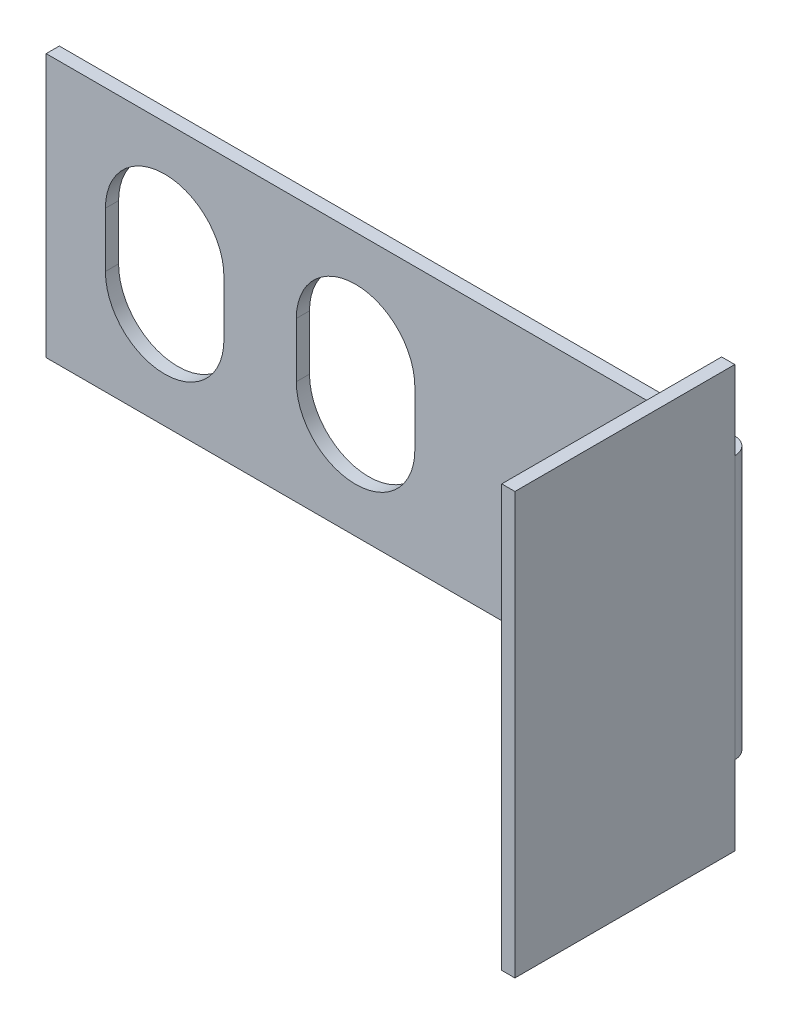
from build123d import *

# Parameters (mm, degrees)
SKETCH1_W                    = 26.3
SKETCH1_H                    = 10
BASE_FLANGE1_DEPTH           = 0.5
EDGE_FLANGE1_STRIP_W         = 2.3
EDGE_FLANGE1_STRIP_H         = 0.5
EDGE_FLANGE1_STRIP_CUT_DEPTH = 10
EDGE_FLANGE1_DEPTH           = 10
EDGE_FLANGE1_PROFILE_W       = 16
EDGE_FLANGE1_PROFILE_H       = 8.35
EDGE_FLANGE1_FLAT_DEPTH      = 0.5
M4_START                     = -0.5
M4_CLEARANCE_SLOT1_DEPTH     = 0.5


# Read off the part's stored shape, not the designer's step: M4 Clearance Slot1
# Sheet-metal steps are written as plain solids
with BuildPart() as part:
    # Sketch1 → Base-Flange1 (new body)
    with BuildSketch(Plane.XY):
        with Locations((13.15, 0)):
            Rectangle(SKETCH1_W, SKETCH1_H)
    extrude(amount=-BASE_FLANGE1_DEPTH)

    # Edge-Flange1 strip (across the edge) → Edge-Flange1 strip cut (cut)
    with BuildSketch(Plane(origin=(26.3, -5, 0), x_dir=(-1, 0, 0), z_dir=(0, 1, 0))):
        with Locations((-0.5, -0.25)):
            Rectangle(EDGE_FLANGE1_STRIP_W, EDGE_FLANGE1_STRIP_H)
    extrude(amount=EDGE_FLANGE1_STRIP_CUT_DEPTH, mode=Mode.SUBTRACT)

    # Edge-Flange1 bend section (across the edge) → Edge-Flange1 (add)
    with BuildSketch(Plane(origin=(26.3, -5, 0), x_dir=(-1, 0, 0), z_dir=(0, 1, 0))):
        with BuildLine():
            Line((0, 0.15), (0.5, 0.15))
            ThreePointArc((0.5, 0.15), (0.543933983, 0.043933983), (0.65, 0))
            Line((0.65, 0), (0.65, -0.5))
            ThreePointArc((0.65, -0.5), (0.190380592, -0.309619408), (0, 0.15))
        make_face()
    extrude(amount=EDGE_FLANGE1_DEPTH)

    # Edge-Flange1 profile (on flange) → Edge-Flange1 flat (add)
    with BuildSketch(Plane.YZ.offset(26.3)):
        with Locations((0, 4.325)):
            Rectangle(EDGE_FLANGE1_PROFILE_W, EDGE_FLANGE1_PROFILE_H)
    extrude(amount=-EDGE_FLANGE1_FLAT_DEPTH)

    # M4 Clearance Slot1 outline → M4 Clearance Slot1 (cut)
    with BuildSketch(Plane.XY.offset(M4_START)):
        with BuildLine():
            Line((14, -1.040099885), (14, 1.040099885))
            ThreePointArc((14, 1.040099885), (11.75, 3.290099885), (9.5, 1.040099885))
            Line((9.5, 1.040099885), (9.5, -1.040099885))
            ThreePointArc((9.5, -1.040099885), (11.75, -3.290099885), (14, -1.040099885))
        make_face()
        with BuildLine():
            Line((6.75, -1.040099885), (6.75, 1.040099885))
            ThreePointArc((6.75, 1.040099885), (4.5, 3.290099885), (2.25, 1.040099885))
            Line((2.25, 1.040099885), (2.25, -1.040099885))
            ThreePointArc((2.25, -1.040099885), (4.5, -3.290099885), (6.75, -1.040099885))
        make_face()
    extrude(amount=M4_CLEARANCE_SLOT1_DEPTH, mode=Mode.SUBTRACT)


solid = part.part
